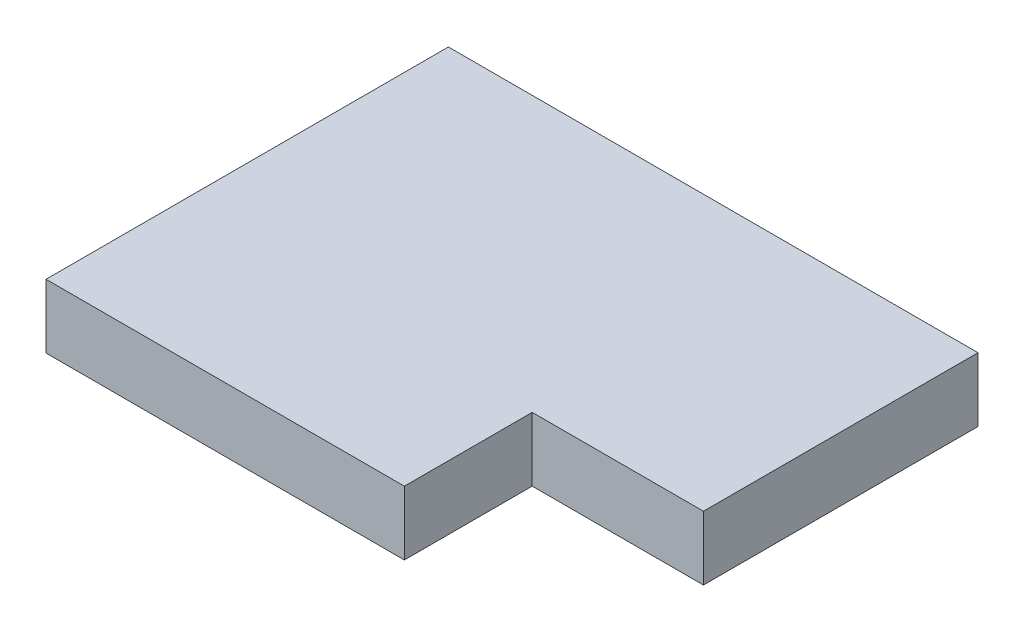
from build123d import *

# Parameters (mm, degrees)
SKETCH1_W           = 870
SKETCH1_H           = 661
BOSS_EXTRUDE1_DEPTH = 105
SKETCH2_W           = 281.3
SKETCH2_H           = 210
CUT_EXTRUDE1_DEPTH  = 557.309491201


with BuildPart() as part:
    # Sketch1 → Boss-Extrude1 (new body)
    with BuildSketch(Plane(origin=(0, 0, 0), x_dir=(1, 0, 0), z_dir=(0, 1, 0))):
        Rectangle(SKETCH1_W, SKETCH1_H)
    extrude(amount=BOSS_EXTRUDE1_DEPTH)

    # Sketch2 → Cut-Extrude1 (cut, through all)
    with BuildSketch(Plane(origin=(0, 105, 0), x_dir=(1, 0, 0), z_dir=(0, 1, 0))):
        with Locations((294.35, -225.5)):
            Rectangle(SKETCH2_W, SKETCH2_H)
    extrude(amount=-CUT_EXTRUDE1_DEPTH, mode=Mode.SUBTRACT)


solid = part.part
